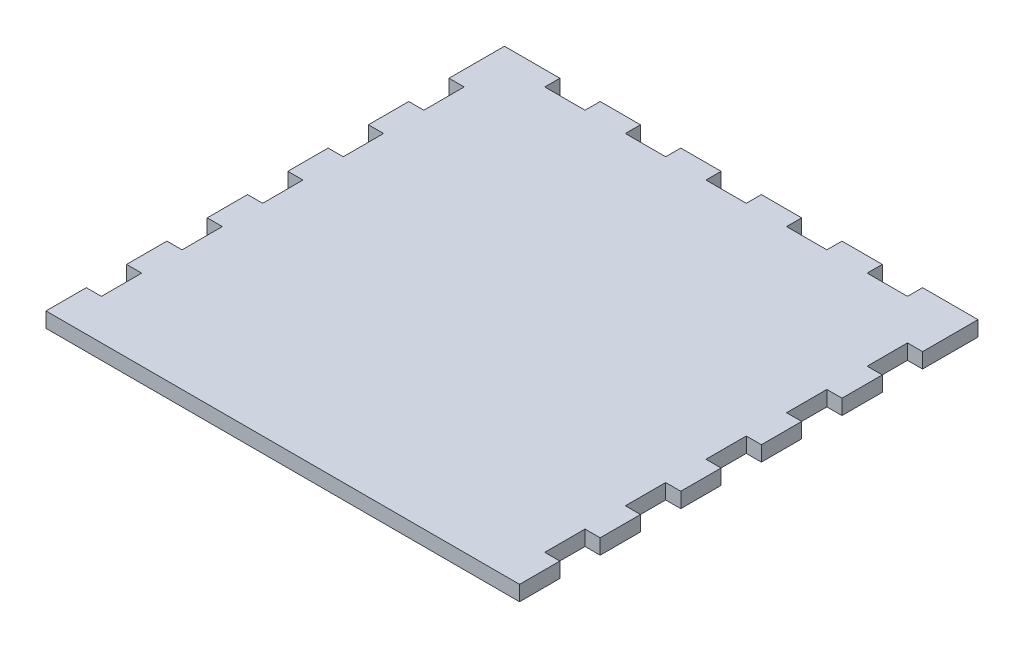
from build123d import *

# Parameters (mm, degrees)
SKETCH1_W               = 279.4
SKETCH1_H               = 279.4
BOSS_EXTRUDE1_DEPTH     = 9.525
SKETCH2_W               = 25.4
SKETCH2_H               = 9.525
BOSS_EXTRUDE2_DEPTH     = 9.525
LPATTERN1_COUNT         = 6
LPATTERN1_PITCH         = 50.8
MIRROR1_COPY_1_SKETCH_W = 25.4
MIRROR1_COPY_1_SKETCH_H = 9.525
MIRROR1_COPY_1_DEPTH    = 9.525
MIRROR1_COPY_2_SKETCH_W = 25.4
MIRROR1_COPY_2_SKETCH_H = 9.525
MIRROR1_COPY_2_DEPTH    = 9.525
MIRROR1_COPY_3_SKETCH_W = 25.4
MIRROR1_COPY_3_SKETCH_H = 9.525
MIRROR1_COPY_3_DEPTH    = 9.525
MIRROR1_COPY_4_SKETCH_W = 25.4
MIRROR1_COPY_4_SKETCH_H = 9.525
MIRROR1_COPY_4_DEPTH    = 9.525
MIRROR1_COPY_5_SKETCH_W = 25.4
MIRROR1_COPY_5_SKETCH_H = 9.525
MIRROR1_COPY_5_DEPTH    = 9.525
MIRROR1_COPY_6_SKETCH_W = 25.4
MIRROR1_COPY_6_SKETCH_H = 9.525
MIRROR1_COPY_6_DEPTH    = 9.525
SKETCH3_W               = 25.4
SKETCH3_H               = 9.525
BOSS_EXTRUDE3_DEPTH     = 9.525
LPATTERN2_COUNT         = 6
LPATTERN2_PITCH         = 50.8
SKETCH5_W               = 9.525
SKETCH5_H               = 9.525
BOSS_EXTRUDE4_DEPTH     = 9.525


with BuildPart() as part:
    # Sketch1 → Boss-Extrude1 (new body)
    with BuildSketch(Plane(origin=(0, 0, 0), x_dir=(1, 0, 0), z_dir=(0, 1, 0))):
        Rectangle(SKETCH1_W, SKETCH1_H)
    extrude(amount=BOSS_EXTRUDE1_DEPTH)

    # Sketch2 → Boss-Extrude2 (add)
    with BuildSketch(Plane(origin=(139.7, 0, 0), x_dir=(0, 0, -1), z_dir=(1, 0, 0))):
        with Locations((-127, 4.7625)):
            Rectangle(SKETCH2_W, SKETCH2_H)
    boss_extrude2 = extrude(amount=BOSS_EXTRUDE2_DEPTH)

    # LPattern1: Boss-Extrude2 ×6
    with Locations(*[(0, 0, -i * LPATTERN1_PITCH) for i in range(1, LPATTERN1_COUNT)]):
        add(boss_extrude2)

    # Mirror1 copy 1 sketch → Mirror1 copy 1 (add)
    with BuildSketch(Plane(origin=(-139.7, 0, -50.8), x_dir=(0, 0, -1), z_dir=(-1, 0, 0))):
        with Locations((-127, -4.7625)):
            Rectangle(MIRROR1_COPY_1_SKETCH_W, MIRROR1_COPY_1_SKETCH_H)
    extrude(amount=MIRROR1_COPY_1_DEPTH)

    # Mirror1 copy 2 sketch → Mirror1 copy 2 (add)
    with BuildSketch(Plane(origin=(-139.7, 0, -101.6), x_dir=(0, 0, -1), z_dir=(-1, 0, 0))):
        with Locations((-127, -4.7625)):
            Rectangle(MIRROR1_COPY_2_SKETCH_W, MIRROR1_COPY_2_SKETCH_H)
    extrude(amount=MIRROR1_COPY_2_DEPTH)

    # Mirror1 copy 3 sketch → Mirror1 copy 3 (add)
    with BuildSketch(Plane(origin=(-139.7, 0, -152.4), x_dir=(0, 0, -1), z_dir=(-1, 0, 0))):
        with Locations((-127, -4.7625)):
            Rectangle(MIRROR1_COPY_3_SKETCH_W, MIRROR1_COPY_3_SKETCH_H)
    extrude(amount=MIRROR1_COPY_3_DEPTH)

    # Mirror1 copy 4 sketch → Mirror1 copy 4 (add)
    with BuildSketch(Plane(origin=(-139.7, 0, -203.2), x_dir=(0, 0, -1), z_dir=(-1, 0, 0))):
        with Locations((-127, -4.7625)):
            Rectangle(MIRROR1_COPY_4_SKETCH_W, MIRROR1_COPY_4_SKETCH_H)
    extrude(amount=MIRROR1_COPY_4_DEPTH)

    # Mirror1 copy 5 sketch → Mirror1 copy 5 (add)
    with BuildSketch(Plane(origin=(-139.7, 0, -254), x_dir=(0, 0, -1), z_dir=(-1, 0, 0))):
        with Locations((-127, -4.7625)):
            Rectangle(MIRROR1_COPY_5_SKETCH_W, MIRROR1_COPY_5_SKETCH_H)
    extrude(amount=MIRROR1_COPY_5_DEPTH)

    # Mirror1 copy 6 sketch → Mirror1 copy 6 (add)
    with BuildSketch(Plane(origin=(-139.7, 0, 0), x_dir=(0, 0, -1), z_dir=(-1, 0, 0))):
        with Locations((-127, -4.7625)):
            Rectangle(MIRROR1_COPY_6_SKETCH_W, MIRROR1_COPY_6_SKETCH_H)
    extrude(amount=MIRROR1_COPY_6_DEPTH)

    # Sketch3 → Boss-Extrude3 (add)
    with BuildSketch(Plane(origin=(0, 0, -139.7), x_dir=(-1, 0, 0), z_dir=(0, 0, -1))):
        with Locations((-127, 4.7625)):
            Rectangle(SKETCH3_W, SKETCH3_H)
    boss_extrude3 = extrude(amount=BOSS_EXTRUDE3_DEPTH)

    # LPattern2: Boss-Extrude3 ×6
    with Locations(*[(-i * LPATTERN2_PITCH, 0, 0) for i in range(1, LPATTERN2_COUNT)]):
        add(boss_extrude3)

    # Sketch5 → Boss-Extrude4 (add)
    with BuildSketch(Plane(origin=(0, 0, -139.7), x_dir=(-1, 0, 0), z_dir=(0, 0, -1))):
        with Locations((-144.4625, 4.7625)):
            Rectangle(SKETCH5_W, SKETCH5_H)
    boss_extrude4 = extrude(amount=BOSS_EXTRUDE4_DEPTH)

    # Mirror2: Boss-Extrude4 across plane
    add(boss_extrude4.mirror(Plane(origin=(0, 0, 0), x_dir=(0, 0, 1), z_dir=(1, 0, 0))))


solid = part.part
